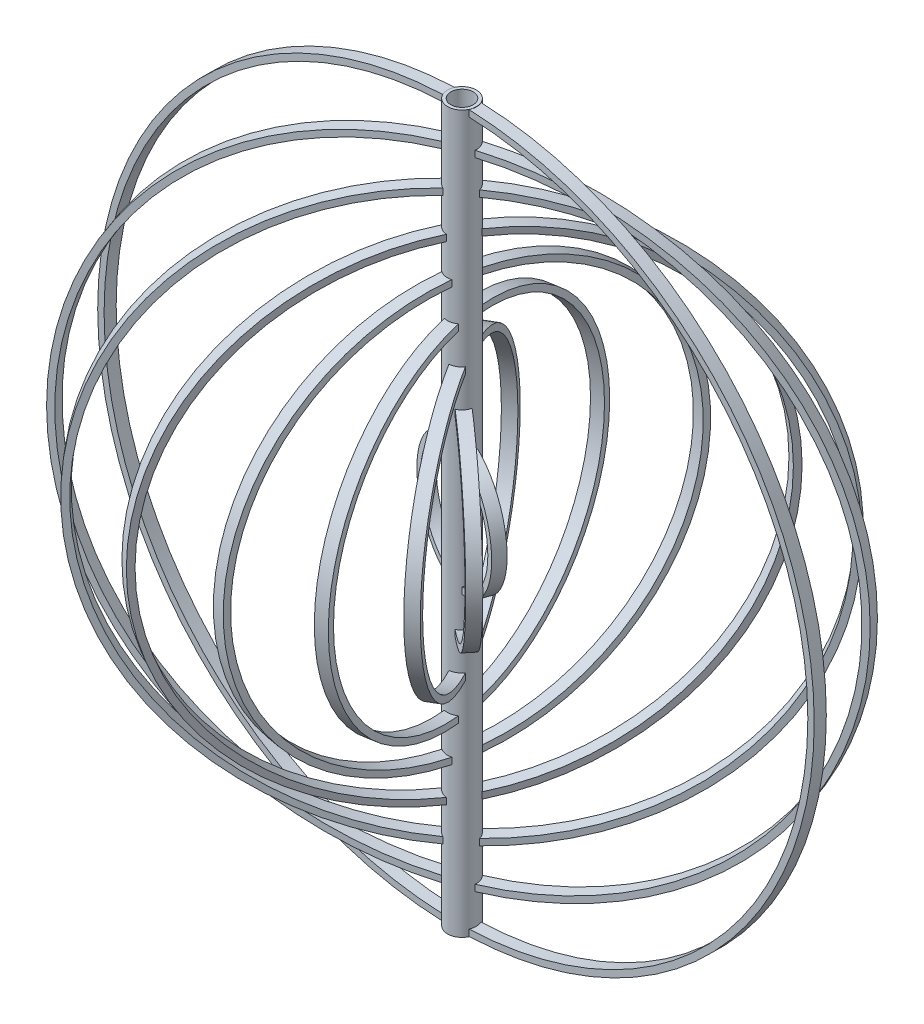
from build123d import *

# Parameters (mm, degrees)
SKETCH1_R                = 355.6
SKETCH1_R_2              = 349.25
BOSS_EXTRUDE1_DEPTH      = 6
BOSS_EXTRUDE2_DEPTH      = 355.6
BOSS_EXTRUDE2_DEPTH_BACK = 355.6
SKETCH2_R                = 14.2875
SKETCH2_R_2              = 11.1125
CIRPATTERN_START         = -6
CIRPATTERN_DEPTH         = 12
CIRPATTERN_2_DEPTH       = 12
CIRPATTERN_3_DEPTH       = 12
CIRPATTERN_4_DEPTH       = 12
CIRPATTERN_5_DEPTH       = 12
CIRPATTERN_6_DEPTH       = 12
CIRPATTERN_7_DEPTH       = 12
CIRPATTERN_8_DEPTH       = 12
CUT_EXTRUDE4_DEPTH       = 548.176711886
CUT_EXTRUDE4_DEPTH_BACK  = 548.176711886
SKETCH12_R               = 11.1125


# Read off the part's stored shape, not the designer's step: CirPattern
with BuildPart() as part:
    # Sketch1 → Boss-Extrude1 (new, symmetric)
    with BuildSketch(Plane.XY):
        Circle(SKETCH1_R)
        Circle(SKETCH1_R_2, mode=Mode.SUBTRACT)
    extrude(amount=BOSS_EXTRUDE1_DEPTH, both=True)


with BuildPart() as body_2:
    # Sketch2 → Boss-Extrude2 (new, two sides: drawn at the far end of the back side and taken through both)
    with BuildSketch(Plane(origin=(0, 0, 0), x_dir=(1, 0, 0), z_dir=(0, 1, 0)).offset(-BOSS_EXTRUDE2_DEPTH_BACK)):
        with Locations(Location((0, 0, 0), (0, 0, 270))):
            Circle(SKETCH2_R)
        with Locations(Location((0, 0, 0), (0, 0, 270))):
            Circle(SKETCH2_R_2, mode=Mode.SUBTRACT)
    extrude(amount=BOSS_EXTRUDE2_DEPTH + BOSS_EXTRUDE2_DEPTH_BACK)


with BuildPart() as part_1:
    add(part.part)

    # Combine: union body 2
    add(body_2.part)

    # CirPattern outline → CirPattern (add)
    with BuildSketch(Plane(origin=(0, 0, 0), x_dir=(0.9396926207859082, 0, -0.3420201433256691), z_dir=(0.3420201433256691, 0, 0.9396926207859083)).offset(CIRPATTERN_START)):
        with BuildLine():
            Line((-12.966597713, -318.647256586), (-12.039926782, -318.684965271))
            Line((-12.039926782, -318.684965271), (-11.11305253, -318.717283576))
            ThreePointArc((-11.11305253, -318.717283576), (0, -318.91097), (11.11305253, -318.717283576))
            Line((11.11305253, -318.717283576), (12.039926782, -318.684965271))
            Line((12.039926782, -318.684965271), (12.966597713, -318.647256586))
            ThreePointArc((12.966597713, -318.647256586), (318.91097, 0), (12.966597713, 318.647256586))
            Line((12.966597713, 318.647256586), (12.039926782, 318.684965271))
            Line((12.039926782, 318.684965271), (11.11305253, 318.717283576))
            ThreePointArc((11.11305253, 318.717283576), (0, 318.91097), (-11.11305253, 318.717283576))
            Line((-11.11305253, 318.717283576), (-12.039926782, 318.684965271))
            Line((-12.039926782, 318.684965271), (-12.966597713, 318.647256586))
            ThreePointArc((-12.966597713, 318.647256586), (-318.91097, 0), (-12.966597713, -318.647256586))
        make_face()
        with BuildLine():
            ThreePointArc((-11.113052532, 312.36334617), (0, 312.56097), (11.113052532, 312.36334617))
            Line((11.113052532, 312.36334617), (12.039931201, 312.330370306))
            Line((12.039931201, 312.330370306), (12.966597713, 312.291894405))
            ThreePointArc((12.966597713, 312.291894405), (312.56097, 0), (12.966597713, -312.291894405))
            Line((12.966597713, -312.291894405), (12.039931201, -312.330370306))
            Line((12.039931201, -312.330370306), (11.113052532, -312.36334617))
            ThreePointArc((11.113052532, -312.36334617), (0, -312.56097), (-11.113052532, -312.36334617))
            Line((-11.113052532, -312.36334617), (-12.039931201, -312.330370306))
            Line((-12.039931201, -312.330370306), (-12.966597713, -312.291894405))
            ThreePointArc((-12.966597713, -312.291894405), (-312.56097, 0), (-12.966597713, 312.291894405))
            Line((-12.966597713, 312.291894405), (-12.039931201, 312.330370306))
            Line((-12.039931201, 312.330370306), (-11.113052532, 312.36334617))
        make_face(mode=Mode.SUBTRACT)
    extrude(amount=CIRPATTERN_DEPTH)

    # CirPattern 2 outline → CirPattern 2 (add)
    with BuildSketch(Plane(origin=(0, 0, 0), x_dir=(0.7660444431189772, 0, -0.6427876096865403), z_dir=(0.6427876096865403, 0, 0.7660444431189772)).offset(CIRPATTERN_START)):
        with BuildLine():
            Line((-12.966597713, -281.923909524), (-12.039955223, -281.966528827))
            Line((-12.039955223, -281.966528827), (-11.113052547, -282.0030558))
            ThreePointArc((-11.113052547, -282.0030558), (0, -282.22194), (11.113052547, -282.0030558))
            Line((11.113052547, -282.0030558), (12.039955223, -281.966528827))
            Line((12.039955223, -281.966528827), (12.966597713, -281.923909524))
            ThreePointArc((12.966597713, -281.923909524), (282.22194, 0), (12.966597713, 281.923909524))
            Line((12.966597713, 281.923909524), (12.039955223, 281.966528827))
            Line((12.039955223, 281.966528827), (11.113052547, 282.0030558))
            ThreePointArc((11.113052547, 282.0030558), (0, 282.22194), (-11.113052547, 282.0030558))
            Line((-11.113052547, 282.0030558), (-12.039955223, 281.966528827))
            Line((-12.039955223, 281.966528827), (-12.966597713, 281.923909524))
            ThreePointArc((-12.966597713, 281.923909524), (-282.22194, 0), (-12.966597713, -281.923909524))
        make_face()
        with BuildLine():
            ThreePointArc((-11.113052551, 275.648013493), (0, 275.87194), (11.113052551, 275.648013493))
            Line((11.113052551, 275.648013493), (12.039961115, 275.610644156))
            Line((12.039961115, 275.610644156), (12.966597713, 275.567041975))
            ThreePointArc((12.966597713, 275.567041975), (275.87194, 0), (12.966597713, -275.567041975))
            Line((12.966597713, -275.567041975), (12.039961115, -275.610644156))
            Line((12.039961115, -275.610644156), (11.113052551, -275.648013493))
            ThreePointArc((11.113052551, -275.648013493), (0, -275.87194), (-11.113052551, -275.648013493))
            Line((-11.113052551, -275.648013493), (-12.039961115, -275.610644156))
            Line((-12.039961115, -275.610644156), (-12.966597713, -275.567041975))
            ThreePointArc((-12.966597713, -275.567041975), (-275.87194, 0), (-12.966597713, 275.567041975))
            Line((-12.966597713, 275.567041975), (-12.039961115, 275.610644156))
            Line((-12.039961115, 275.610644156), (-11.113052551, 275.648013493))
        make_face(mode=Mode.SUBTRACT)
    extrude(amount=CIRPATTERN_2_DEPTH)

    # CirPattern 3 outline → CirPattern 3 (add)
    with BuildSketch(Plane(origin=(0, 0, 0), x_dir=(0.49999999999999767, 0, -0.86602540378444), z_dir=(0.8660254037844399, 0, 0.49999999999999795)).offset(CIRPATTERN_START)):
        with BuildLine():
            Line((-12.966597713, -245.190287811), (-12.039846137, -245.239297969))
            Line((-12.039846137, -245.239297969), (-11.112750644, -245.281301094))
            ThreePointArc((-11.112750644, -245.281301094), (0.000151119, -245.53291), (11.113052573, -245.281287414))
            Line((11.113052573, -245.281287414), (12.03999713, -245.239289984))
            Line((12.03999713, -245.239289984), (12.966597713, -245.190287811))
            ThreePointArc((12.966597713, -245.190287811), (245.53291, 0), (12.966597713, 245.190287811))
            Line((12.966597713, 245.190287811), (12.03999713, 245.239289984))
            Line((12.03999713, 245.239289984), (11.113052573, 245.281287414))
            ThreePointArc((11.113052573, 245.281287414), (0.000151163, 245.53291), (-11.112750556, 245.281301098))
            Line((-11.112750556, 245.281301098), (-12.039846091, 245.239297972))
            Line((-12.039846091, 245.239297972), (-12.966597713, 245.190287811))
            ThreePointArc((-12.966597713, 245.190287811), (-245.53291, 0), (-12.966597713, -245.190287811))
        make_face()
        with BuildLine():
            ThreePointArc((-11.112750548, 238.924614076), (0.000151179, 239.18291), (11.113052579, 238.924600028))
            Line((11.113052579, 238.924600028), (12.040006324, 238.881484812))
            Line((12.040006324, 238.881484812), (12.966597713, 238.831178408))
            ThreePointArc((12.966597713, 238.831178408), (239.18291, 0), (12.966597713, -238.831178408))
            Line((12.966597713, -238.831178408), (12.040006324, -238.881484812))
            Line((12.040006324, -238.881484812), (11.113052579, -238.924600028))
            ThreePointArc((11.113052579, -238.924600028), (0.000151136, -239.18291), (-11.112750634, -238.924614072))
            Line((-11.112750634, -238.924614072), (-12.039855424, -238.881493005))
            Line((-12.039855424, -238.881493005), (-12.966597713, -238.831178408))
            ThreePointArc((-12.966597713, -238.831178408), (-239.18291, 0), (-12.966597713, 238.831178408))
            Line((-12.966597713, 238.831178408), (-12.039855382, 238.881493007))
            Line((-12.039855382, 238.881493007), (-11.112750548, 238.924614076))
        make_face(mode=Mode.SUBTRACT)
    extrude(amount=CIRPATTERN_3_DEPTH)

    # CirPattern 4 outline → CirPattern 4 (add)
    with BuildSketch(Plane(origin=(0, 0, 0), x_dir=(0, 1, 0), z_dir=(0.9848077530122088, 0, 0.17364817766692697)).offset(CIRPATTERN_START)):
        with BuildLine():
            Line((-208.440959404, 12.966597713), (-208.498602243, 12.039976182))
            Line((-208.498602243, 12.039976182), (-208.548004401, 11.112878735))
            ThreePointArc((-208.548004401, 11.112878735), (-208.84388, -8.7063e-05), (-208.547995136, -11.113052614))
            Line((-208.547995136, -11.113052614), (-208.498596841, -12.040063012))
            Line((-208.498596841, -12.040063012), (-208.440959404, -12.966597713))
            ThreePointArc((-208.440959404, -12.966597713), (0, -208.84388), (208.440959404, -12.966597713))
            Line((208.440959404, -12.966597713), (208.498596841, -12.040063011))
            Line((208.498596841, -12.040063011), (208.547995136, -11.113052614))
            ThreePointArc((208.547995136, -11.113052614), (208.84388, -8.7305e-05), (208.548004427, 11.112878252))
            Line((208.548004427, 11.112878252), (208.49860226, 12.039975907))
            Line((208.49860226, 12.039975907), (208.440959404, 12.966597713))
            ThreePointArc((208.440959404, 12.966597713), (0, 208.84388), (-208.440959404, 12.966597713))
        make_face()
        with BuildLine():
            ThreePointArc((202.188712279, 11.112878309), (202.49388, -8.7289e-05), (202.188702698, -11.113052623))
            Line((202.188702698, -11.113052623), (202.137749874, -12.040078324))
            Line((202.137749874, -12.040078324), (202.07829864, -12.966597713))
            ThreePointArc((202.07829864, -12.966597713), (0, -202.49388), (-202.07829864, -12.966597713))
            Line((-202.07829864, -12.966597713), (-202.137749874, -12.040078321))
            Line((-202.137749874, -12.040078321), (-202.188702698, -11.113052623))
            ThreePointArc((-202.188702698, -11.113052623), (-202.49388, -8.7046e-05), (-202.188712253, 11.112878793))
            Line((-202.188712253, 11.112878793), (-202.137755454, 12.039991366))
            Line((-202.137755454, 12.039991366), (-202.07829864, 12.966597713))
            ThreePointArc((-202.07829864, 12.966597713), (0, 202.49388), (202.07829864, 12.966597713))
            Line((202.07829864, 12.966597713), (202.137755464, 12.039991198))
            Line((202.137755464, 12.039991198), (202.188712279, 11.112878309))
        make_face(mode=Mode.SUBTRACT)
    extrude(amount=CIRPATTERN_4_DEPTH)

    # CirPattern 5 outline → CirPattern 5 (add)
    with BuildSketch(Plane(origin=(0, 0, 0), x_dir=(0, 1, 0), z_dir=(0.9848077530122075, 0, -0.17364817766693408)).offset(CIRPATTERN_START)):
        with BuildLine():
            Line((-171.66583744, 12.966596877), (-171.735820219, 12.040089144))
            Line((-171.735820219, 12.040089144), (-171.795798197, 11.112879928))
            ThreePointArc((-171.795798197, 11.112879928), (-172.15485, -8.6242e-05), (-171.795787063, -11.113052053))
            Line((-171.795787063, -11.113052053), (-171.735813752, -12.040174691))
            Line((-171.735813752, -12.040174691), (-171.665837505, -12.966596017))
            ThreePointArc((-171.665837505, -12.966596017), (-1.27e-07, -172.15485), (171.665837486, -12.96659627))
            Line((171.665837486, -12.96659627), (171.73581371, -12.040175268))
            Line((171.73581371, -12.040175268), (171.79578701, -11.113052867))
            ThreePointArc((171.79578701, -11.113052867), (172.15485, -8.8992e-05), (171.7957985, 11.112875255))
            Line((171.7957985, 11.112875255), (171.735820424, 12.040086374))
            Line((171.735820424, 12.040086374), (171.665837487, 12.966596248))
            ThreePointArc((171.665837487, 12.966596248), (3.15e-07, 172.15485), (-171.66583744, 12.966596877))
        make_face()
        with BuildLine():
            ThreePointArc((165.432017113, 11.112875308), (165.80485, -8.8982e-05), (165.432005185, -11.113052872))
            Line((165.432005185, -11.113052872), (165.36972301, -12.040202706))
            Line((165.36972301, -12.040202706), (165.297052802, -12.96659626))
            ThreePointArc((165.297052802, -12.96659626), (-1.19e-07, -165.80485), (-165.29705282, -12.966596021))
            Line((-165.29705282, -12.966596021), (-165.369723047, -12.040202203))
            Line((-165.369723047, -12.040202203), (-165.432005239, -11.113052055))
            ThreePointArc((-165.432005239, -11.113052055), (-165.80485, -8.6206e-05), (-165.432016795, 11.112880031))
            Line((-165.432016795, 11.112880031), (-165.369729759, 12.040116715))
            Line((-165.369729759, 12.040116715), (-165.297052754, 12.96659687))
            ThreePointArc((-165.297052754, 12.96659687), (3.22e-07, 165.80485), (165.297052804, 12.966596227))
            Line((165.297052804, 12.966596227), (165.369729974, 12.040113919))
            Line((165.369729974, 12.040113919), (165.432017113, 11.112875308))
        make_face(mode=Mode.SUBTRACT)
    extrude(amount=CIRPATTERN_5_DEPTH)

    # CirPattern 6 outline → CirPattern 6 (add)
    with BuildSketch(Plane(origin=(0, 0, 0), x_dir=(0.500000000000004, 0, 0.8660254037844363), z_dir=(0.8660254037844363, 0, -0.5000000000000042)).offset(CIRPATTERN_START)):
        with BuildLine():
            Line((12.966597713, 134.843819777), (12.040242207, 134.932898232))
            Line((12.040242207, 134.932898232), (11.112750205, 135.009241058))
            ThreePointArc((11.112750205, 135.009241058), (-0.000151819, 135.46582), (-11.11305282, 135.009216149))
            Line((-11.11305282, 135.009216149), (-12.040393345, 134.932883699))
            Line((-12.040393345, 134.932883699), (-12.966597713, 134.843819777))
            ThreePointArc((-12.966597713, 134.843819777), (-135.46582, 0), (-12.966597713, -134.843819777))
            Line((-12.966597713, -134.843819777), (-12.040393344, -134.932883699))
            Line((-12.040393344, -134.932883699), (-11.11305282, -135.009216149))
            ThreePointArc((-11.11305282, -135.009216149), (-0.000151799, -135.46582), (11.112750245, -135.009241055))
            Line((11.112750245, -135.009241055), (12.040242204, -134.932898233))
            Line((12.040242204, -134.932898233), (12.966597713, -134.843819777))
            ThreePointArc((12.966597713, -134.843819777), (135.46582, 0), (12.966597713, 134.843819777))
        make_face()
        with BuildLine():
            ThreePointArc((11.112750187, -128.63670455), (-0.000151898, -129.11582), (-11.113052856, -128.636678403))
            Line((-11.113052856, -128.636678403), (-12.040451049, -128.556559534))
            Line((-12.040451049, -128.556559534), (-12.966597713, -128.463077645))
            ThreePointArc((-12.966597713, -128.463077645), (-129.11582, 0), (-12.966597713, 128.463077645))
            Line((-12.966597713, 128.463077645), (-12.040451049, 128.556559534))
            Line((-12.040451049, 128.556559534), (-11.113052856, 128.636678403))
            ThreePointArc((-11.113052856, 128.636678403), (-0.000151914, 129.11582), (11.112750155, 128.636704553))
            Line((11.112750155, 128.636704553), (12.040299916, 128.556574789))
            Line((12.040299916, 128.556574789), (12.966597713, 128.463077645))
            ThreePointArc((12.966597713, 128.463077645), (129.11582, 0), (12.966597713, -128.463077645))
            Line((12.966597713, -128.463077645), (12.040299951, -128.556574786))
            Line((12.040299951, -128.556574786), (11.112750187, -128.63670455))
        make_face(mode=Mode.SUBTRACT)
    extrude(amount=CIRPATTERN_6_DEPTH)

    # CirPattern 7 outline → CirPattern 7 (add)
    with BuildSketch(Plane(origin=(0, 0, 0), x_dir=(0.7660444431189818, 0, 0.642787609686535), z_dir=(0.6427876096865349, 0, -0.7660444431189818)).offset(CIRPATTERN_START)):
        with BuildLine():
            Line((12.966597713, 97.922017884), (12.040901414, 98.044596358))
            Line((12.040901414, 98.044596358), (11.11305314, 98.149652534))
            ThreePointArc((11.11305314, 98.149652534), (0, 98.77679), (-11.11305314, 98.149652534))
            Line((-11.11305314, 98.149652534), (-12.040901414, 98.044596358))
            Line((-12.040901414, 98.044596358), (-12.966597713, 97.922017884))
            ThreePointArc((-12.966597713, 97.922017884), (-98.77679, 0), (-12.966597713, -97.922017884))
            Line((-12.966597713, -97.922017884), (-12.040901414, -98.044596358))
            Line((-12.040901414, -98.044596358), (-11.11305314, -98.149652534))
            ThreePointArc((-11.11305314, -98.149652534), (0, -98.77679), (11.11305314, -98.149652534))
            Line((11.11305314, -98.149652534), (12.040901414, -98.044596358))
            Line((12.040901414, -98.044596358), (12.966597713, -97.922017884))
            ThreePointArc((12.966597713, -97.922017884), (98.77679, 0), (12.966597713, 97.922017884))
        make_face()
        with BuildLine():
            ThreePointArc((11.11305324, -91.75626168), (0, -92.42679), (-11.11305324, -91.75626168))
            Line((-11.11305324, -91.75626168), (-12.04105697, -91.643866573))
            Line((-12.04105697, -91.643866573), (-12.966597713, -91.51272509))
            ThreePointArc((-12.966597713, -91.51272509), (-92.42679, 0), (-12.966597713, 91.51272509))
            Line((-12.966597713, 91.51272509), (-12.04105697, 91.643866573))
            Line((-12.04105697, 91.643866573), (-11.11305324, 91.75626168))
            ThreePointArc((-11.11305324, 91.75626168), (0, 92.42679), (11.11305324, 91.75626168))
            Line((11.11305324, 91.75626168), (12.04105697, 91.643866573))
            Line((12.04105697, 91.643866573), (12.966597713, 91.51272509))
            ThreePointArc((12.966597713, 91.51272509), (92.42679, 0), (12.966597713, -91.51272509))
            Line((12.966597713, -91.51272509), (12.04105697, -91.643866573))
            Line((12.04105697, -91.643866573), (11.11305324, -91.75626168))
        make_face(mode=Mode.SUBTRACT)
    extrude(amount=CIRPATTERN_7_DEPTH)

    # CirPattern 8 outline → CirPattern 8 (add)
    with BuildSketch(Plane(origin=(0, 0, 0), x_dir=(0.9396926207859105, 0, 0.34202014332566283), z_dir=(0.34202014332566283, 0, -0.9396926207859105)).offset(CIRPATTERN_START)):
        with BuildLine():
            Line((12.966596246, 60.718673599), (12.042612618, 60.915992182))
            Line((12.042612618, 60.915992182), (11.113052859, 61.085104551))
            ThreePointArc((11.113052859, 61.085104551), (-1.062e-06, 62.08776), (-11.113054949, 61.08510417))
            Line((-11.113054949, 61.08510417), (-12.042613882, 60.915991918))
            Line((-12.042613882, 60.915991918), (-12.966596622, 60.718673519))
            ThreePointArc((-12.966596622, 60.718673519), (-62.08776, -9e-09), (-12.966596604, -60.718673522))
            Line((-12.966596604, -60.718673522), (-12.042613897, -60.915991914))
            Line((-12.042613897, -60.915991914), (-11.113055042, -61.085104153))
            ThreePointArc((-11.113055042, -61.085104153), (-9.86e-07, -62.08776), (11.113053102, -61.085104506))
            Line((11.113053102, -61.085104506), (12.042612601, -60.915992181))
            Line((12.042612601, -60.915992181), (12.966595931, -60.718673666))
            ThreePointArc((12.966595931, -60.718673666), (62.08776, -1.61e-07), (12.966596246, 60.718673599))
        make_face()
        with BuildLine():
            ThreePointArc((11.113053287, -54.618659233), (-1.167e-06, -55.73776), (-11.113055574, -54.618658768))
            Line((-11.113055574, -54.618658768), (-12.043318529, -54.429381621))
            Line((-12.043318529, -54.429381621), (-12.966596286, -54.208535034))
            ThreePointArc((-12.966596286, -54.208535034), (-55.73776, -1.9e-08), (-12.966596324, 54.208535025))
            Line((-12.966596324, 54.208535025), (-12.043318517, 54.429381624))
            Line((-12.043318517, 54.429381624), (-11.113055537, 54.618658776))
            ThreePointArc((-11.113055537, 54.618658776), (-1.21e-06, 55.73776), (11.113053165, 54.618659258))
            Line((11.113053165, 54.618659258), (12.043317313, 54.429381911))
            Line((12.043317313, 54.429381911), (12.966596236, 54.208535046))
            ThreePointArc((12.966596236, 54.208535046), (55.73776, 1.09e-07), (12.966596448, -54.208534996))
            Line((12.966596448, -54.208534996), (12.043317507, -54.429381869))
            Line((12.043317507, -54.429381869), (11.113053287, -54.618659233))
        make_face(mode=Mode.SUBTRACT)
    extrude(amount=CIRPATTERN_8_DEPTH)

    # Sketch12 → Cut-Extrude4 (cut, two sides: drawn at the far end of the back side and taken through both)
    with BuildSketch(Plane(origin=(0, 0, 0), x_dir=(1, 0, 0), z_dir=(0, 1, 0)).offset(-CUT_EXTRUDE4_DEPTH_BACK)):
        with Locations(Location((0, 0, 0), (0, 0, 270))):
            Circle(SKETCH12_R)
    extrude(amount=CUT_EXTRUDE4_DEPTH + CUT_EXTRUDE4_DEPTH_BACK, mode=Mode.SUBTRACT)


solid = part_1.part
